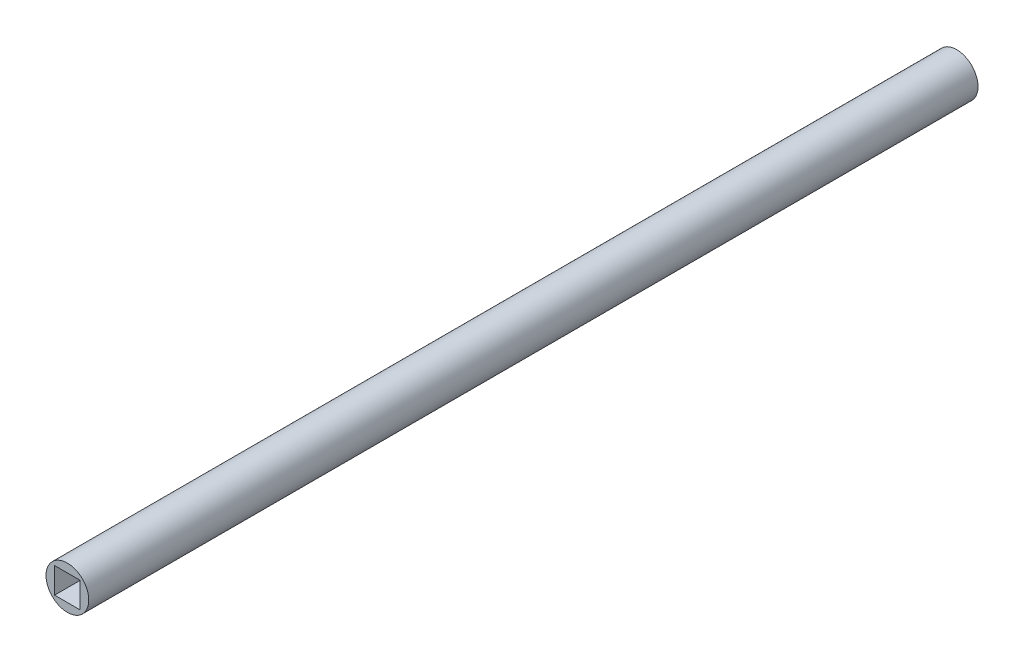
from build123d import *

# Parameters (mm, degrees)
SKETCH1_W          = 15.875
SKETCH1_H          = 660.4
SKETCH2_W          = 19.05
SKETCH2_H          = 19.05
CUT_EXTRUDE1_DEPTH = 661.781500384


with BuildPart() as part:
    # Sketch1 → Revolve1 (revolve)
    with BuildSketch(Plane(origin=(0, 0, 0), x_dir=(1, 0, 0), z_dir=(0, 1, 0))):
        with Locations((-7.9375, -330.2)):
            Rectangle(SKETCH1_W, SKETCH1_H)
    revolve(axis=Axis((0, 0, 0), (0, 0, 1)))

    # Sketch2 → Cut-Extrude1 (cut, through all)
    with BuildSketch(Plane.XY.offset(660.4)):
        Rectangle(SKETCH2_W, SKETCH2_H)
    extrude(amount=-CUT_EXTRUDE1_DEPTH, mode=Mode.SUBTRACT)


solid = part.part
